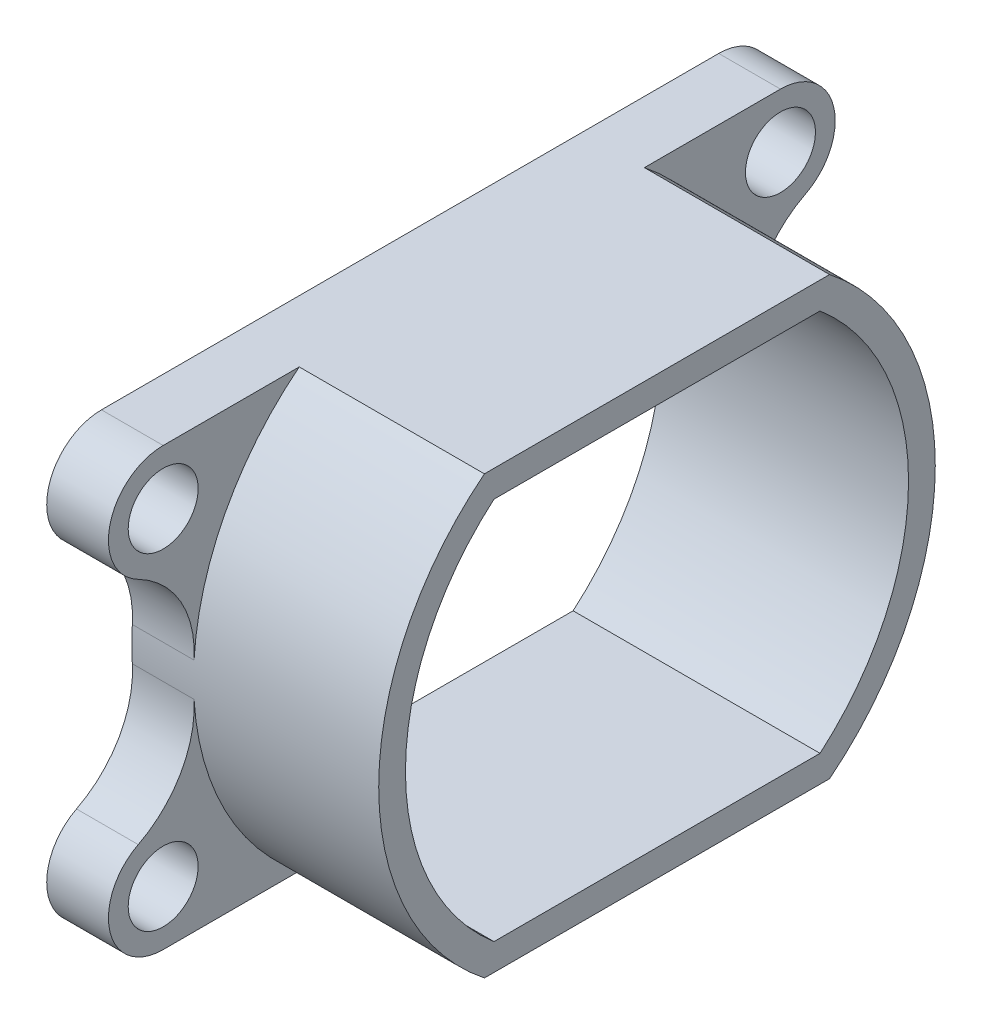
from build123d import *

# Parameters (mm, degrees)
MOTOR_HOLDER_DEPTH  = 12
SKETCH2_R           = 1.7
BOSS_EXTRUDE1_DEPTH = 3
FILLET1_R           = 5


with BuildPart() as part:
    # Sketch1 → Motor Holder (new body)
    with BuildSketch(Plane(origin=(0, 0, 0), x_dir=(0, 0, -1), z_dir=(1, 0, 0))):
        with BuildLine():
            Line((-8.387700817, 10.61), (8.387700817, 10.61))
            ThreePointArc((8.387700817, 10.61), (13.525, 0), (8.387700817, -10.61))
            Line((8.387700817, -10.61), (-8.387700817, -10.61))
            ThreePointArc((-8.387700817, -10.61), (-13.525, 0), (-8.387700817, 10.61))
        make_face()
        with BuildLine():
            Line((-7.923037612, 9.31), (7.923037612, 9.31))
            ThreePointArc((7.923037612, 9.31), (12.225, 0), (7.923037612, -9.31))
            Line((7.923037612, -9.31), (-7.923037612, -9.31))
            ThreePointArc((-7.923037612, -9.31), (-12.225, 0), (-7.923037612, 9.31))
        make_face(mode=Mode.SUBTRACT)
    extrude(amount=MOTOR_HOLDER_DEPTH)

    # Sketch2 → Boss-Extrude1 (add)
    # profile 1 of 4: a face of its own
    with BuildSketch(Plane.ZY):
        with BuildLine():
            Line((-15.86201317, 5.433547478), (-12.795120435, 4.382980497))
            ThreePointArc((-12.795120435, 4.382980497), (-11.039561677, 7.8136869), (-8.387700817, 10.61))
            Line((-8.387700817, 10.61), (-15, 10.61))
            ThreePointArc((-15, 10.61), (-17.623867728, 8.386941811), (-15.86201317, 5.433547478))
        make_face()
        with Locations((-15, 7.95)):
            Circle(SKETCH2_R, mode=Mode.SUBTRACT)
    # profile 2 of 4: a face of its own
    with BuildSketch(Plane.ZY):
        with BuildLine():
            Line((-15, -10.61), (-8.387700817, -10.61))
            ThreePointArc((-8.387700817, -10.61), (-11.039561677, -7.8136869), (-12.795120435, -4.382980497))
            Line((-12.795120435, -4.382980497), (-15.86201317, -5.433547478))
            ThreePointArc((-15.86201317, -5.433547478), (-17.623867728, -8.386941811), (-15, -10.61))
        make_face()
        with Locations((-15, -7.95)):
            Circle(SKETCH2_R, mode=Mode.SUBTRACT)
    # profile 3 of 4: a face of its own
    with BuildSketch(Plane.ZY):
        with BuildLine():
            Line((15.86201317, -5.433547478), (12.795120435, -4.382980497))
            ThreePointArc((12.795120435, -4.382980497), (11.039561677, -7.8136869), (8.387700817, -10.61))
            Line((8.387700817, -10.61), (15, -10.61))
            ThreePointArc((15, -10.61), (17.623867728, -8.386941811), (15.86201317, -5.433547478))
        make_face()
        with Locations((15, -7.95)):
            Circle(SKETCH2_R, mode=Mode.SUBTRACT)
    # profile 4 of 4: a face of its own
    with BuildSketch(Plane.ZY):
        with BuildLine():
            Line((15, 10.61), (8.387700817, 10.61))
            ThreePointArc((8.387700817, 10.61), (11.039561677, 7.8136869), (12.795120435, 4.382980497))
            Line((12.795120435, 4.382980497), (15.86201317, 5.433547478))
            ThreePointArc((15.86201317, 5.433547478), (17.623867728, 8.386941811), (15, 10.61))
        make_face()
        with Locations((15, 7.95)):
            Circle(SKETCH2_R, mode=Mode.SUBTRACT)
    extrude(amount=-BOSS_EXTRUDE1_DEPTH)

    # Fillet1
    # the kernel refuses this fillet: 5 mm, written as the material it adds along each edge
    with BuildSketch(Plane(origin=(0, -4.382980497, -12.795120435), x_dir=(0, -0.3311587269792296, -0.9435750619561202), z_dir=(1, 0, 0)), Plane(origin=(0, 4.382980497, 12.795120435), x_dir=(0, 0.3311587269792292, 0.9435750619561204), z_dir=(1, 0, 0))) as fillet1_piece_1:
        with BuildLine():
            CenterArc((4.297165601, 4.954108155), FILLET1_R, 195.837486713, 66.393727894)
            Line((-0.513032618, 3.589559476), (-0.99405244, 3.453104608))
            ThreePointArc((-0.99405244, 3.453104608), (-0.630646565, 1.74130771), (-0.499985908, -0.003753963))
            Line((-0.499985908, -0.003753963), (0.003753963, -0.499985908))
            ThreePointArc((0.003753963, -0.499985908), (3.245501889, -0.475646418), (3.553698727, -0.495410815))
            Line((3.553698727, -0.495410815), (3.621286625, 0))
        make_face()
    extrude(amount=3)
    with BuildSketch(Plane(origin=(0, 4.382980497, -12.795120435), x_dir=(0, 0.3311587269792287, -0.9435750619561205), z_dir=(1, 0, 0)), Plane(origin=(0, -4.382980497, 12.795120435), x_dir=(0, -0.3311587269792296, 0.9435750619561202), z_dir=(1, 0, 0))) as fillet1_piece_2:
        with BuildLine():
            CenterArc((4.297165601, -4.954108155), FILLET1_R, 97.768785393, 66.393727894)
            Line((-0.513032618, -3.589559476), (-0.99405244, -3.453104608))
            ThreePointArc((-0.99405244, -3.453104608), (-0.630646565, -1.74130771), (-0.499985908, 0.003753963))
            Line((-0.499985908, 0.003753963), (0.003753963, 0.499985908))
            ThreePointArc((0.003753963, 0.499985908), (3.245501889, 0.475646418), (3.553698727, 0.495410815))
            Line((3.553698727, 0.495410815), (3.621286625, 0))
        make_face()
    extrude(amount=3)


solid = part.part
